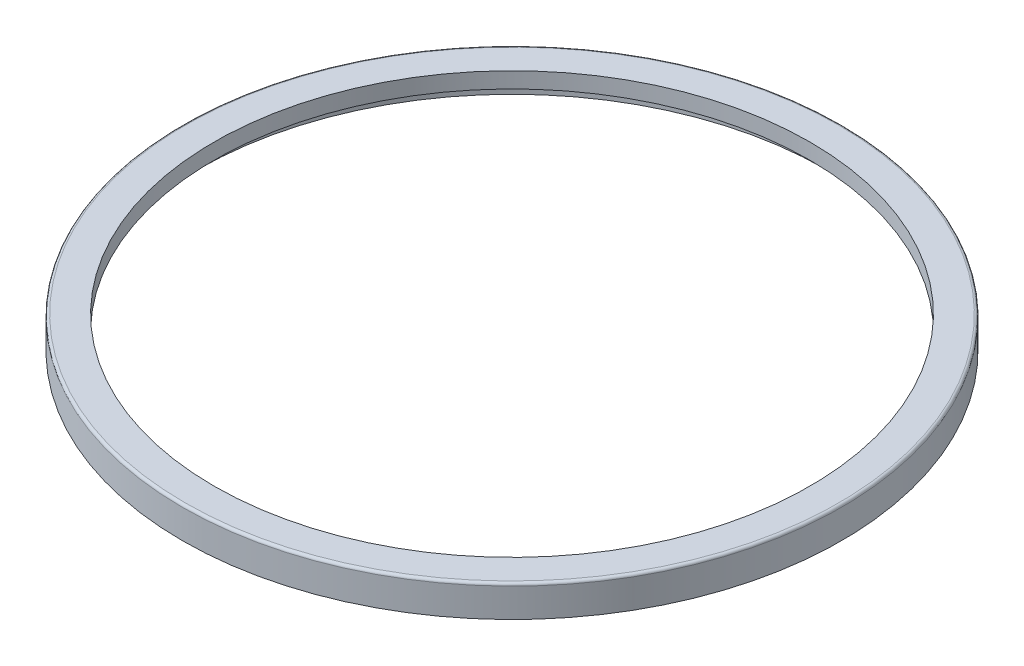
from build123d import *

# Parameters (mm, degrees)
FILLET1_R = 1.5875
FILLET2_R = 0.508


with BuildPart() as part:
    # Sketch1 → Revolve1 (revolve)
    with BuildSketch(Plane.XY):
        Polygon((-57.56402, 0), (-63.66002, 0), (-63.66002, -6.096), (-60.61202, -6.096), (-60.61202, -3.048), (-57.56402, -3.048), align=None)
    revolve(axis=Axis((0, 0, 0), (0, 1, 0)))

    # Fillet1
    fillet1_edges = [part.edges().sort_by_distance(p)[0] for p in [
        (60.61202, -3.048, 0),
    ]]
    fillet(fillet1_edges, radius=FILLET1_R)

    # Fillet2
    fillet2_edges = [part.edges().sort_by_distance(p)[0] for p in [
        (63.66002, 0, 0),
    ]]
    fillet(fillet2_edges, radius=FILLET2_R)


solid = part.part
